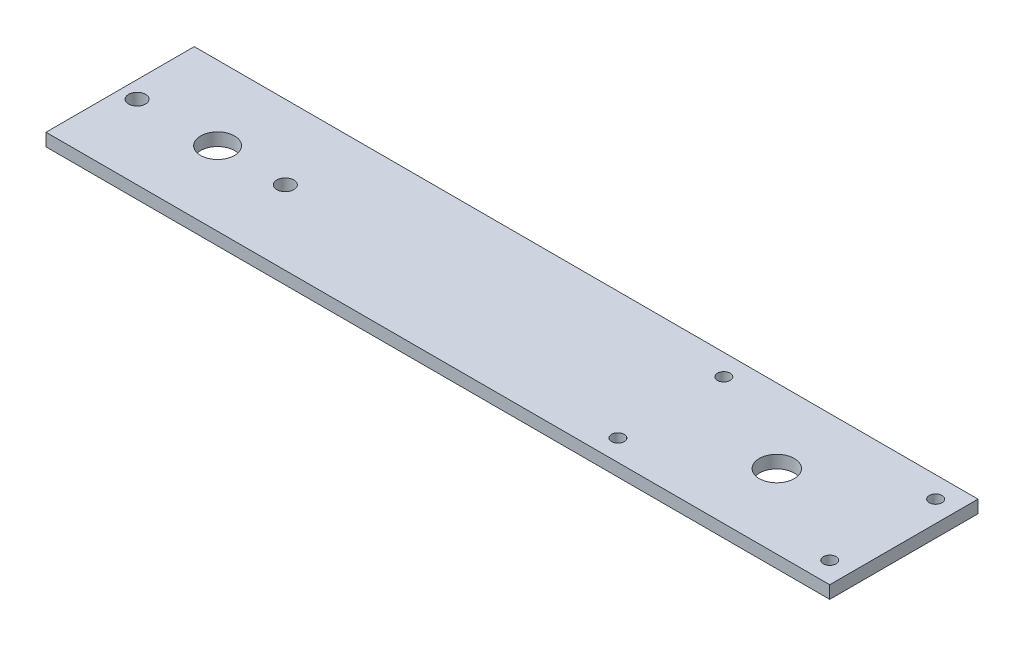
from build123d import *

# Parameters (mm, degrees)
SKETCH1_W           = 185
SKETCH1_H           = 35
SKETCH1_R           = 4.125
SKETCH1_R_2         = 4
SKETCH1_R_3         = 2
BOSS_EXTRUDE1_DEPTH = 3
SKETCH6_R           = 1.5
CUT_EXTRUDE6_DEPTH  = 95.188640504


with BuildPart() as part:
    # Sketch1 → Boss-Extrude1 (new body)
    with BuildSketch(Plane(origin=(0, 0, 0), x_dir=(1, 0, 0), z_dir=(0, 1, 0))):
        Rectangle(SKETCH1_W, SKETCH1_H)
        with Locations((62.5, 0)):
            Circle(SKETCH1_R, mode=Mode.SUBTRACT)
        with Locations((-69.5, 0)):
            Circle(SKETCH1_R_2, mode=Mode.SUBTRACT)
        with Locations((-88.5, 0)):
            Circle(SKETCH1_R_3, mode=Mode.SUBTRACT)
        with Locations((-53.5, 0)):
            Circle(SKETCH1_R_3, mode=Mode.SUBTRACT)
    extrude(amount=BOSS_EXTRUDE1_DEPTH)

    # Sketch6 → Cut-Extrude6 (cut, through all)
    with BuildSketch(Plane(origin=(0, 3, 0), x_dir=(1, 0, 0), z_dir=(0, 1, 0))):
        with Locations((87.5, 12.5)):
            Circle(SKETCH6_R)
        with Locations((87.5, -12.5)):
            Circle(SKETCH6_R)
        with Locations((37.5, -12.5)):
            Circle(SKETCH6_R)
        with Locations((37.5, 12.5)):
            Circle(SKETCH6_R)
    extrude(amount=-CUT_EXTRUDE6_DEPTH, mode=Mode.SUBTRACT)


solid = part.part
